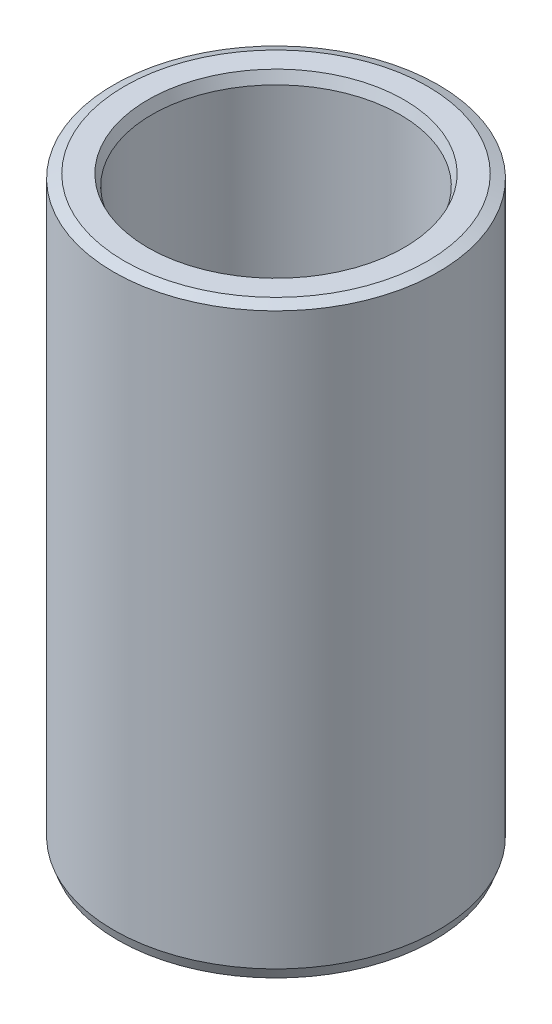
from build123d import *
from OCP.BRepFilletAPI import BRepFilletAPI_MakeChamfer

# Parameters (mm, degrees)
SKETCH1_R           = 32.5
BOSS_EXTRUDE1_DEPTH = 117.128344231
SKETCH2_R           = 24.837066933
CUT_EXTRUDE1_DEPTH  = 126.823483589
CHAMFER1_SIZE       = 0.824318548
CHAMFER1_SIZE2      = 2.151377892


with BuildPart() as part:
    # Sketch1 → Boss-Extrude1 (new body)
    with BuildSketch(Plane(origin=(0, 0, 0), x_dir=(1, 0, 0), z_dir=(0, 1, 0))):
        Circle(SKETCH1_R)
    extrude(amount=BOSS_EXTRUDE1_DEPTH)

    # Sketch2 → Cut-Extrude1 (cut, through all)
    with BuildSketch(Plane(origin=(0, 0, 0), x_dir=(1, 0, 0), z_dir=(0, 1, 0))):
        Circle(SKETCH2_R)
    extrude(amount=CUT_EXTRUDE1_DEPTH, mode=Mode.SUBTRACT)

    # Chamfer1: one chamfer whose edges measure the first distance from different faces: ONE call of the kernel's chamfer builder (chamfer() names one face for all edges)
    chamfer1_edges_1 = [part.edges().sort_by_distance(p)[0] for p in [
        (-24.837066933, 117.128344231, 0),
    ]]
    chamfer1_side_1 = [part.faces().sort_by_distance(p)[0] for p in [
        (-31.580761184, 117.128344231, 0),
    ]]
    chamfer1_edges_2 = [part.edges().sort_by_distance(p)[0] for p in [
        (-24.837066933, 0, 0),
    ]]
    chamfer1_side_2 = [part.faces().sort_by_distance(p)[0] for p in [
        (-24.837066933, 58.564172116, 0),
    ]]
    chamfer1_edges_3 = [part.edges().sort_by_distance(p)[0] for p in [
        (-32.5, 0, 0),
    ]]
    chamfer1_side_3 = [part.faces().sort_by_distance(p)[0] for p in [
        (-31.580761184, 0, 0),
    ]]
    chamfer1_edges_4 = [part.edges().sort_by_distance(p)[0] for p in [
        (-32.5, 117.128344231, 0),
    ]]
    chamfer1_side_4 = [part.faces().sort_by_distance(p)[0] for p in [
        (-32.5, 58.564172116, 0),
    ]]
    chamfer1 = BRepFilletAPI_MakeChamfer(part.part.solid().wrapped)
    for e in chamfer1_edges_1:
        chamfer1.Add(CHAMFER1_SIZE, CHAMFER1_SIZE2, e.wrapped, chamfer1_side_1[0].wrapped)  # the first distance lies on this face
    for e in chamfer1_edges_2:
        chamfer1.Add(CHAMFER1_SIZE, CHAMFER1_SIZE2, e.wrapped, chamfer1_side_2[0].wrapped)  # the first distance lies on this face
    for e in chamfer1_edges_3:
        chamfer1.Add(CHAMFER1_SIZE, CHAMFER1_SIZE2, e.wrapped, chamfer1_side_3[0].wrapped)  # the first distance lies on this face
    for e in chamfer1_edges_4:
        chamfer1.Add(CHAMFER1_SIZE, CHAMFER1_SIZE2, e.wrapped, chamfer1_side_4[0].wrapped)  # the first distance lies on this face
    add(Compound.cast(chamfer1.Shape()), mode=Mode.REPLACE)


solid = part.part
